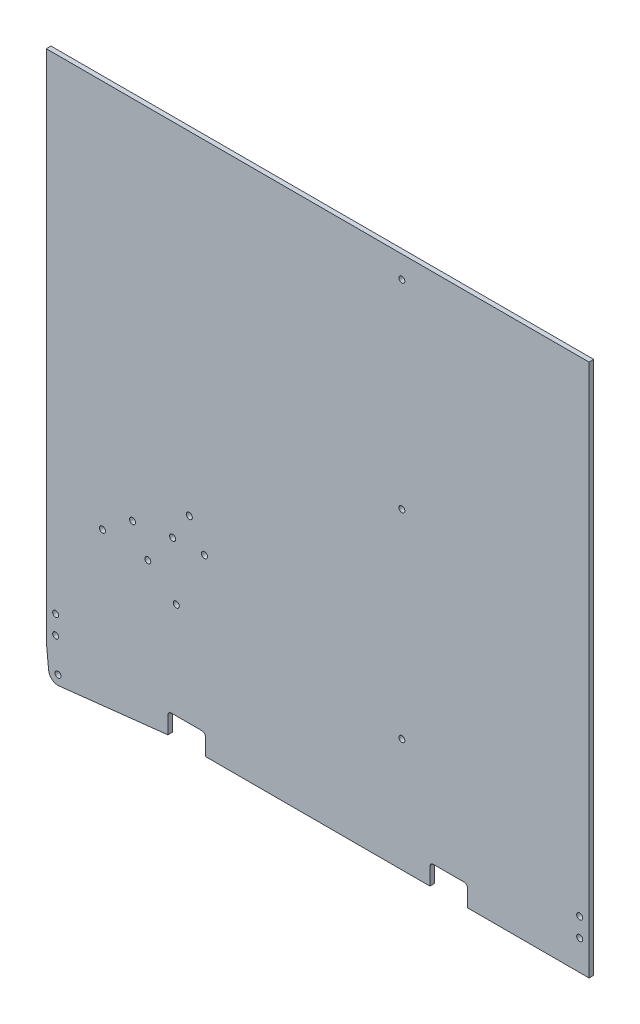
from build123d import *

# Parameters (mm, degrees)
SKETCH1_R           = 2.032
SKETCH1_R_2         = 2
BOSS_EXTRUDE1_DEPTH = 3.175
FILLET1_R           = 2.286


with BuildPart() as part:
    # Sketch1 → Boss-Extrude1 (new body)
    with BuildSketch(Plane.XY):
        with BuildLine():
            Line((82.55, -20.32), (82.55, -6.35))
            Line((82.55, -6.35), (107.95, -6.35))
            Line((107.95, -6.35), (107.95, -20.32))
            Line((107.95, -20.32), (260.35, -20.32))
            Line((260.35, -20.32), (260.35, -6.35))
            Line((260.35, -6.35), (285.75, -6.35))
            Line((285.75, -6.35), (285.75, -20.32))
            Line((285.75, -20.32), (368.3, -20.32))
            Line((368.3, -20.32), (368.3, 341.63))
            Line((368.3, 341.63), (0, 341.63))
            Line((0, 341.63), (0, 0))
            Line((0, 0), (0, -6.35))
            ThreePointArc((0, -6.35), (0.007883354, -6.666317007), (0.031513842, -6.981848616))
            Line((0.031513842, -6.981848616), (1.619013842, -22.856848616))
            ThreePointArc((1.619013842, -22.856848616), (3.943628298, -27.161748811), (8.639060666, -28.536126099))
            Line((8.639060666, -28.536126099), (82.55, -20.32))
        make_face()
        with Locations((6.35, 0)):
            Circle(SKETCH1_R, mode=Mode.SUBTRACT)
        with Locations((6.35, 12.7)):
            Circle(SKETCH1_R, mode=Mode.SUBTRACT)
        with Locations((361.95, 0)):
            Circle(SKETCH1_R, mode=Mode.SUBTRACT)
        with Locations((361.95, 12.7)):
            Circle(SKETCH1_R, mode=Mode.SUBTRACT)
        with Locations((7.9375, -22.225)):
            Circle(SKETCH1_R, mode=Mode.SUBTRACT)
        with Locations((38.1, 78.105)):
            Circle(SKETCH1_R, mode=Mode.SUBTRACT)
        with Locations((85.725, 97.155)):
            Circle(SKETCH1_R, mode=Mode.SUBTRACT)
        with Locations((58.568579744, 93.391299635)):
            Circle(SKETCH1_R, mode=Mode.SUBTRACT)
        with Locations((68.887329744, 75.518700365)):
            Circle(SKETCH1_R, mode=Mode.SUBTRACT)
        with Locations((107.382158942, 97.743700365)):
            Circle(SKETCH1_R, mode=Mode.SUBTRACT)
        with Locations((97.063408942, 115.616299635)):
            Circle(SKETCH1_R, mode=Mode.SUBTRACT)
        with Locations((88.216909404, 59.136578314)):
            Circle(SKETCH1_R, mode=Mode.SUBTRACT)
        with Locations((241.3, 56.63)):
            Circle(SKETCH1_R_2, mode=Mode.SUBTRACT)
        with Locations((241.3, 191.63)):
            Circle(SKETCH1_R_2, mode=Mode.SUBTRACT)
        with Locations((241.3, 326.63)):
            Circle(SKETCH1_R_2, mode=Mode.SUBTRACT)
    extrude(amount=BOSS_EXTRUDE1_DEPTH)

    # Fillet1
    fillet1_edges = [part.edges().sort_by_distance(p)[0] for p in [
        (285.75, -6.35, 1.5875),
        (107.95, -6.35, 1.5875),
        (260.35, -6.35, 1.5875),
        (82.55, -6.35, 1.5875),
    ]]
    fillet(fillet1_edges, radius=FILLET1_R)


solid = part.part
